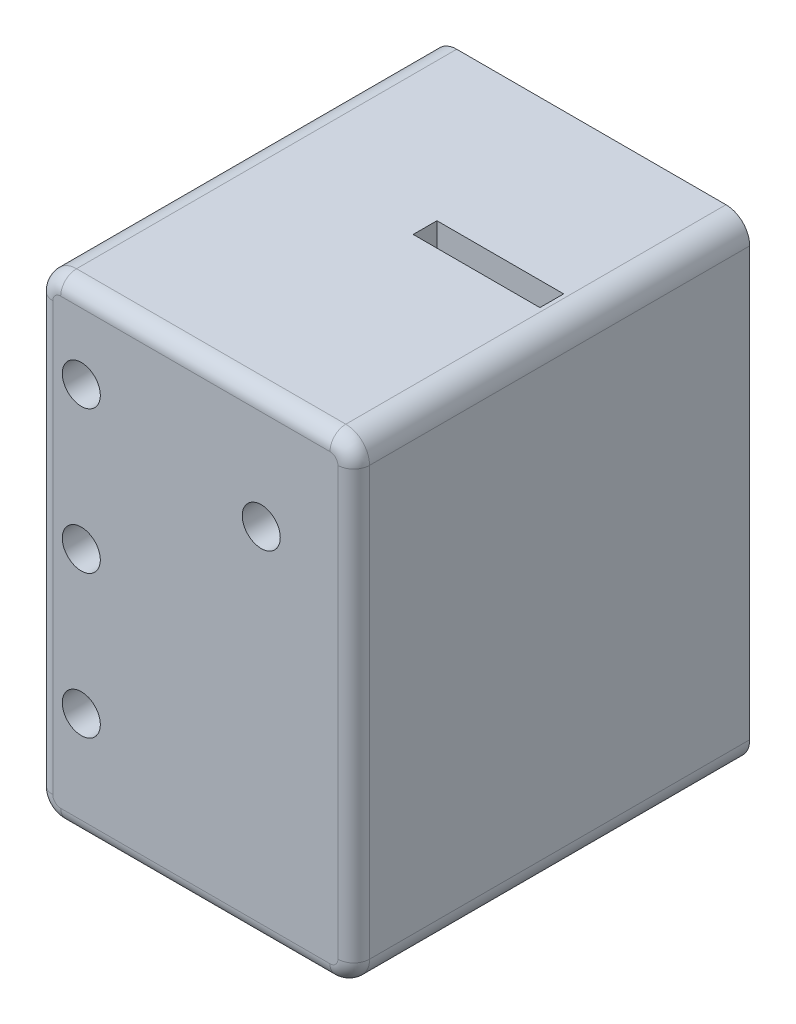
from build123d import *

# Parameters (mm, degrees)
SKETCH1_W               = 20
SKETCH1_H               = 30
BOSS_EXTRUDE1_DEPTH     = 25
CUT_EXTRUDE2_DEPTH      = 44.874821937
CUT_EXTRUDE2_DEPTH_BACK = 44.874821937
SKETCH4_W               = 8
SKETCH4_H               = 1.5
SKETCH5_W               = 8
SKETCH5_H               = 11.5
CUT_EXTRUDE3_DEPTH      = 15
SKETCH6_W               = 6.664038992
SKETCH6_H               = 13
CUT_EXTRUDE4_DEPTH      = 28
SKETCH7_W               = 8
SKETCH7_H               = 9
CUT_EXTRUDE5_DEPTH      = 3
SKETCH11_W              = 6.664038992
SKETCH11_H              = 2
BOSS_EXTRUDE2_DEPTH     = 13
SKETCH12_W              = 8
SKETCH12_H              = 2
BOSS_EXTRUDE3_DEPTH     = 11.5
SKETCH13_W              = 13
SKETCH13_H              = 26
CUT_EXTRUDE7_DEPTH      = 4
SKETCH18_R              = 1.2
CUT_EXTRUDE8_DEPTH      = 44.874821937
LPATTERN1_COUNT         = 3
LPATTERN1_PITCH         = 9
SKETCH19_W              = 4.7
SKETCH19_H              = 13
BOSS_EXTRUDE5_DEPTH     = 6
FILLET1_R               = 1.5
FILLET2_R               = 1
FILLET3_R               = 1
FILLET4_R               = 1
FILLET5_R               = 1
FILLET6_R               = 1
FILLET7_R               = 1
FILLET8_R               = 1
FILLET9_R               = 1
FILLET11_R              = 1
SKETCH20_R              = 1.2
CUT_EXTRUDE9_DEPTH      = 44.874821937


with BuildPart() as part:
    # Sketch1 → Boss-Extrude1 (new body)
    with BuildSketch(Plane.XY):
        with Locations((10, -15)):
            Rectangle(SKETCH1_W, SKETCH1_H)
    extrude(amount=BOSS_EXTRUDE1_DEPTH)

    # Sketch4 → Cut-Extrude2 (cut, two sides: drawn at the far end of the back side and taken through both)
    with BuildSketch(Plane.XZ.offset(30).offset(-CUT_EXTRUDE2_DEPTH_BACK)):
        with Locations((14.251880329, 10.75)):
            Rectangle(SKETCH4_W, SKETCH4_H)
    extrude(amount=CUT_EXTRUDE2_DEPTH + CUT_EXTRUDE2_DEPTH_BACK, mode=Mode.SUBTRACT)

    # Sketch5 → Cut-Extrude3 (cut)
    with BuildSketch(Plane(origin=(0, 0, 0), x_dir=(1, 0, 0), z_dir=(0, 1, 0))):
        with Locations((14.251880329, -17.25)):
            Rectangle(SKETCH5_W, SKETCH5_H)
    extrude(amount=-CUT_EXTRUDE3_DEPTH, mode=Mode.SUBTRACT)

    # Sketch6 → Cut-Extrude4 (cut)
    with BuildSketch(Plane.XZ.offset(30)):
        with Locations((6.919860833, 16.5)):
            Rectangle(SKETCH6_W, SKETCH6_H)
    extrude(amount=-CUT_EXTRUDE4_DEPTH, mode=Mode.SUBTRACT)

    # Sketch7 → Cut-Extrude5 (cut)
    with BuildSketch(Plane.XY.offset(10)):
        with Locations((14.251880329, -7.5)):
            Rectangle(SKETCH7_W, SKETCH7_H)
    extrude(amount=-CUT_EXTRUDE5_DEPTH, mode=Mode.SUBTRACT)

    # Sketch11 → Boss-Extrude2 (add)
    with BuildSketch(Plane.XY.offset(10)):
        with Locations((6.919860833, -29)):
            Rectangle(SKETCH11_W, SKETCH11_H)
    extrude(amount=BOSS_EXTRUDE2_DEPTH)

    # Sketch12 → Boss-Extrude3 (add)
    with BuildSketch(Plane(origin=(0, 0, 23), x_dir=(-1, 0, 0), z_dir=(0, 0, -1))):
        with Locations((-14.251880329, -1)):
            Rectangle(SKETCH12_W, SKETCH12_H)
    extrude(amount=BOSS_EXTRUDE3_DEPTH)

    # Sketch13 → Cut-Extrude7 (cut)
    with BuildSketch(Plane.ZY):
        with Locations((16.5, -15)):
            Rectangle(SKETCH13_W, SKETCH13_H)
    extrude(amount=-CUT_EXTRUDE7_DEPTH, mode=Mode.SUBTRACT)

    # Sketch18 → Cut-Extrude8 (cut, symmetric)
    with BuildSketch(Plane(origin=(0, 0, 0), x_dir=(-1, 0, 0), z_dir=(0, 0, -1))):
        with Locations((-2.8, -23.174436274)):
            Circle(SKETCH18_R)
    cut_extrude8 = extrude(amount=CUT_EXTRUDE8_DEPTH, both=True, mode=Mode.SUBTRACT)

    # LPattern1: Cut-Extrude8 ×3
    with Locations(*[(0, i * LPATTERN1_PITCH, 0) for i in range(1, LPATTERN1_COUNT)]):
        add(cut_extrude8, mode=Mode.SUBTRACT)

    # Sketch19 → Boss-Extrude5 (add)
    with BuildSketch(Plane.ZY.offset(-10.251880329)):
        with Locations((20.65, -21.5)):
            Rectangle(SKETCH19_W, SKETCH19_H)
    extrude(amount=BOSS_EXTRUDE5_DEPTH)

    # Fillet1
    fillet1_edges = [part.edges().sort_by_distance(p)[0] for p in [
        (20, 0, 12.5),
        (20, -30, 12.5),
        (0, -30, 12.5),
        (0, 0, 12.5),
    ]]
    fillet(fillet1_edges, radius=FILLET1_R)

    # Fillet2
    fillet2_edges = [part.edges().sort_by_distance(p)[0] for p in [
        (10.251880329, -21.5, 18.3),
    ]]
    fillet(fillet2_edges, radius=FILLET2_R)

    # Fillet3
    fillet3_edges = [part.edges().sort_by_distance(p)[0] for p in [
        (10.251880329, -7.5, 10),
    ]]
    fillet(fillet3_edges, radius=FILLET3_R)

    # Fillet4
    fillet4_edges = [part.edges().sort_by_distance(p)[0] for p in [
        (18.251880329, -8.5, 23),
    ]]
    fillet(fillet4_edges, radius=FILLET4_R)

    # Fillet5
    fillet5_edges = [part.edges().sort_by_distance(p)[0] for p in [
        (10, 0, 25),
        (20, -15, 25),
        (0, -15, 25),
        (10, -30, 25),
        (0.439339828, -29.560660172, 25),
        (19.560660172, -29.560660172, 25),
        (0.439339828, -0.439339828, 25),
        (19.560660172, -0.439339828, 25),
    ]]
    fillet(fillet5_edges, radius=FILLET5_R)

    # Fillet6
    fillet6_edges = [part.edges().sort_by_distance(p)[0] for p in [
        (18.251880329, -7.5, 7),
        (10.251880329, -7.5, 7),
    ]]
    fillet(fillet6_edges, radius=FILLET6_R)

    # Fillet7
    fillet7_edges = [part.edges().sort_by_distance(p)[0] for p in [
        (18.251880329, -15, 16.75),
        (17.95898711, -15, 22.707106781),
        (10.751880329, -15, 23),
    ]]
    fillet(fillet7_edges, radius=FILLET7_R)

    # Fillet8
    fillet8_edges = [part.edges().sort_by_distance(p)[0] for p in [
        (8.625940164, -2, 23),
        (17.95898711, -2, 22.707106781),
        (18.251880329, -2, 16.75),
    ]]
    fillet(fillet8_edges, radius=FILLET8_R)

    # Fillet9
    # the kernel refuses this fillet: 1 mm, written as the material it takes off along each edge
    with BuildSketch(Plane(origin=(4.251880329, -15, 22), x_dir=(0, -1, 0), z_dir=(0, 0, -1))) as fillet9_piece_1:
        with BuildLine():
            CenterArc((FILLET9_R, -FILLET9_R), FILLET9_R, 90, 90)
            Line((0, -FILLET9_R), (0, 0))
            Line((0, 0), (FILLET9_R, 0))
        make_face()
    extrude(amount=6.2, mode=Mode.SUBTRACT)
    with BuildSketch(Plane(origin=(4.251880329, -14, 22), x_dir=(0, 0.5976672776328242, -0.8017442392976507), z_dir=(0, -0.8017442392976507, -0.5976672776328242))) as fillet9_piece_2_section:
        with BuildLine():
            CenterArc((1 + FILLET9_R, FILLET9_R), FILLET9_R, 180, 90)
            Line((1 + FILLET9_R, 0), (1, 0))
            Line((1, 0), (1, FILLET9_R))
        make_face()
    fillet9_piece_2 = revolve(axis=Axis((4.251880329, -14, 22), (1, 0, 0)), revolution_arc=233.296989237, mode=Mode.PRIVATE)
    fillet9_piece_2 = split(fillet9_piece_2, bisect_by=Plane(origin=(4.563508846, -14.749938848, 23), z_dir=(0, 0, -1)), keep=Keep.TOP, mode=Mode.PRIVATE)
    add(fillet9_piece_2, mode=Mode.SUBTRACT)

    # Fillet11
    fillet11_edges = [part.edges().sort_by_distance(p)[0] for p in [
        (4.251880329, -28, 20.65),
    ]]
    fillet(fillet11_edges, radius=FILLET11_R)

    # Sketch20 → Cut-Extrude9 (cut, through all)
    with BuildSketch(Plane.XY.offset(25)):
        with Locations((14.161317573, -7.269489093)):
            Circle(SKETCH20_R)
    extrude(amount=-CUT_EXTRUDE9_DEPTH, mode=Mode.SUBTRACT)


solid = part.part
